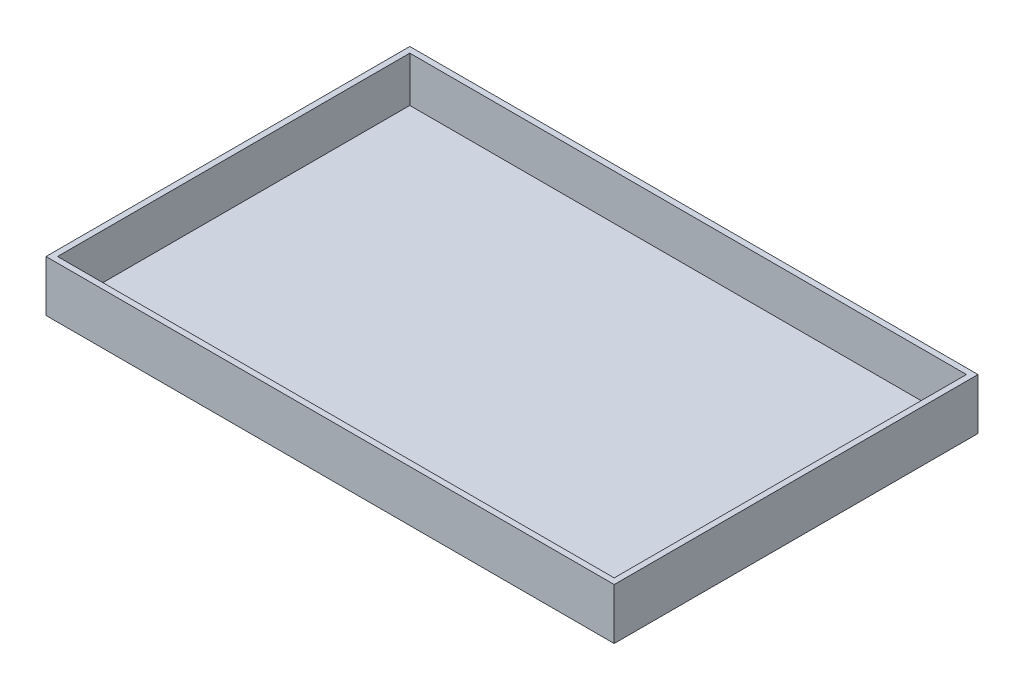
from build123d import *

# Parameters (mm, degrees)
SKETCH1_W           = 2499
SKETCH1_H           = 1600
BOSS_EXTRUDE1_DEPTH = 260
SHELL1_T            = 25.4
SKETCH2_W           = 2499
SKETCH2_H           = 1600
CUT_EXTRUDE1_DEPTH  = 35.306


with BuildPart() as part:
    # Sketch1 → Boss-Extrude1 (new body)
    with BuildSketch(Plane(origin=(0, 0, 0), x_dir=(1, 0, 0), z_dir=(0, 1, 0))):
        Rectangle(SKETCH1_W, SKETCH1_H)
    extrude(amount=BOSS_EXTRUDE1_DEPTH)

    # Shell1 (no face opened: a closed hollow body)
    add(offset(amount=-SHELL1_T, mode=Mode.PRIVATE), mode=Mode.SUBTRACT)

    # Sketch2 → Cut-Extrude1 (cut)
    with BuildSketch(Plane(origin=(0, 260, 0), x_dir=(1, 0, 0), z_dir=(0, 1, 0))):
        Rectangle(SKETCH2_W, SKETCH2_H)
    extrude(amount=-CUT_EXTRUDE1_DEPTH, mode=Mode.SUBTRACT)


solid = part.part
